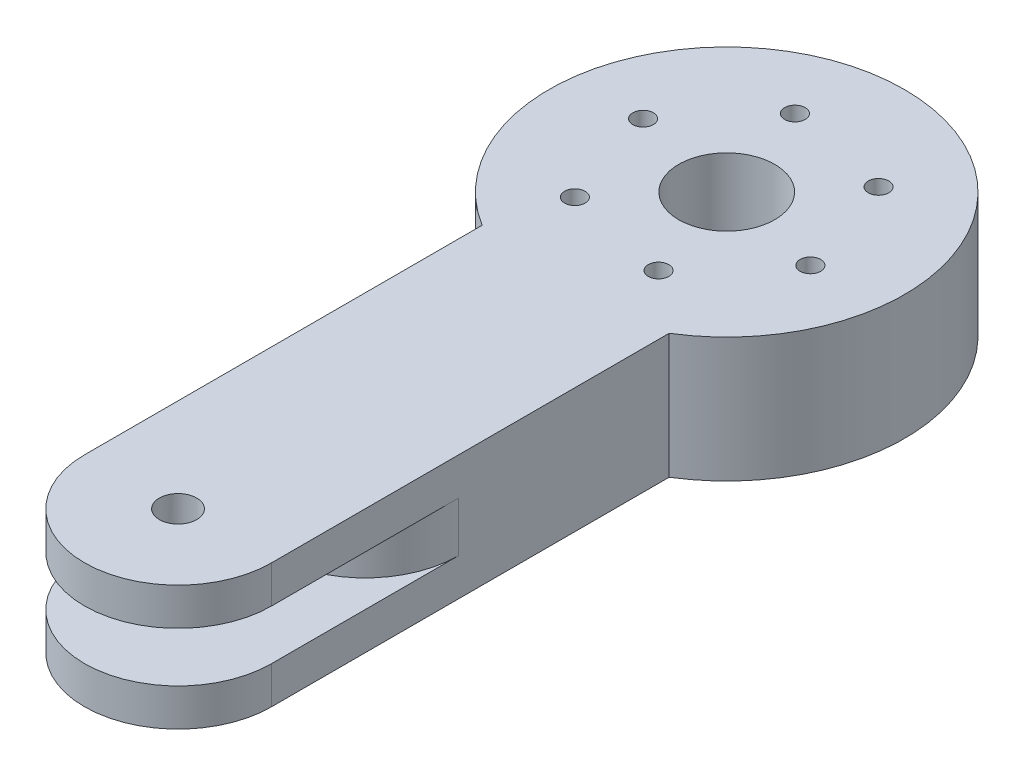
from build123d import *

# Parameters (mm, degrees)
SKETCH_2_R          = 28.5
SKETCH_2_R_2        = 1.65
SKETCH_2_R_3        = 7.7
EXTRUDE_2_DEPTH     = 20
EXTRUDE_START       = -6
EXTRUDE_3_DEPTH     = 6
EXTRUDE_START_2     = 8
EXTRUDE_4_DEPTH     = 8
EXTRUDE_START_3     = 6
EXTRUDE_5_DEPTH     = 6
SKETCH_7_R          = 3
CUT_EXTRUDE_4_DEPTH = 20


with BuildPart() as part:
    # 草图2 → 凸台-拉伸2 (new body)
    with BuildSketch(Plane(origin=(0, 10, 0), x_dir=(0, 0, -1), z_dir=(0, 1, 0))):
        with Locations((-10.824457271, 40.125190792)):
            Circle(SKETCH_2_R)
        with Locations((-14.303615873, 23.229689751)):
            Circle(SKETCH_2_R_2, mode=Mode.SUBTRACT)
        with Locations((-27.195969683, 34.690480004)):
            Circle(SKETCH_2_R_2, mode=Mode.SUBTRACT)
        with Locations((2.067896539, 28.664400538)):
            Circle(SKETCH_2_R_2, mode=Mode.SUBTRACT)
        with Locations((-23.716811081, 51.585981045)):
            Circle(SKETCH_2_R_2, mode=Mode.SUBTRACT)
        with Locations((-10.824457271, 40.125190792)):
            Circle(SKETCH_2_R_3, mode=Mode.SUBTRACT)
        with Locations((5.547055141, 45.559901579)):
            Circle(SKETCH_2_R_2, mode=Mode.SUBTRACT)
        with Locations((-7.345298669, 57.020691832)):
            Circle(SKETCH_2_R_2, mode=Mode.SUBTRACT)
    extrude(amount=EXTRUDE_2_DEPTH)

    # 草图3 → 凸台-拉伸3 (add)
    with BuildSketch(Plane(origin=(0, 30, 0), x_dir=(1, 0, 0), z_dir=(0, 1, 0)).offset(EXTRUDE_START)):
        with BuildLine():
            ThreePointArc((-25.125190792, -35.057698903), (-40.125190792, -39.324457271), (-55.125190792, -35.057698903))
            Line((-55.125190792, -35.057698903), (-55.125190792, -98.824457271))
            ThreePointArc((-55.125190792, -98.824457271), (-40.125190792, -113.824457271), (-25.125190792, -98.824457271))
            Line((-25.125190792, -98.824457271), (-25.125190792, -35.057698903))
        make_face()
    extrude(amount=EXTRUDE_3_DEPTH)

    # 草图5 → 凸台-拉伸4 (add)
    with BuildSketch(Plane(origin=(0, 24, 0), x_dir=(-1, 0, 0), z_dir=(0, -1, 0)).offset(EXTRUDE_START_2)):
        with BuildLine():
            Line((55.125190792, -68.824205807), (55.125190792, -35.057698903))
            ThreePointArc((55.125190792, -35.057698903), (40.125190792, -39.324457271), (25.125190792, -35.057698903))
            Line((25.125190792, -35.057698903), (25.125190792, -68.824205807))
            ThreePointArc((25.125190792, -68.824205807), (40.125190792, -83.824205807), (55.125190792, -68.824205807))
        make_face()
    extrude(amount=-EXTRUDE_4_DEPTH)

    # 草图6 → 凸台-拉伸5 (add)
    with BuildSketch(Plane(origin=(0, 16, 0), x_dir=(-1, 0, 0), z_dir=(0, -1, 0)).offset(EXTRUDE_START_3)):
        with BuildLine():
            ThreePointArc((55.125190792, -35.057698903), (40.125190792, -39.324457271), (25.125190792, -35.057698903))
            Line((25.125190792, -35.057698903), (25.125190792, -98.824457271))
            ThreePointArc((25.125190792, -98.824457271), (40.125190792, -113.824457271), (55.125190792, -98.824457271))
            Line((55.125190792, -98.824457271), (55.125190792, -35.057698903))
        make_face()
    extrude(amount=-EXTRUDE_5_DEPTH)

    # 草图7 → 切除-拉伸4 (cut)
    with BuildSketch(Plane(origin=(0, 10, 0), x_dir=(-1, 0, 0), z_dir=(0, -1, 0))):
        with Locations((40.125725395, -98.822710565)):
            Circle(SKETCH_7_R)
    extrude(amount=-CUT_EXTRUDE_4_DEPTH, mode=Mode.SUBTRACT)


solid = part.part
